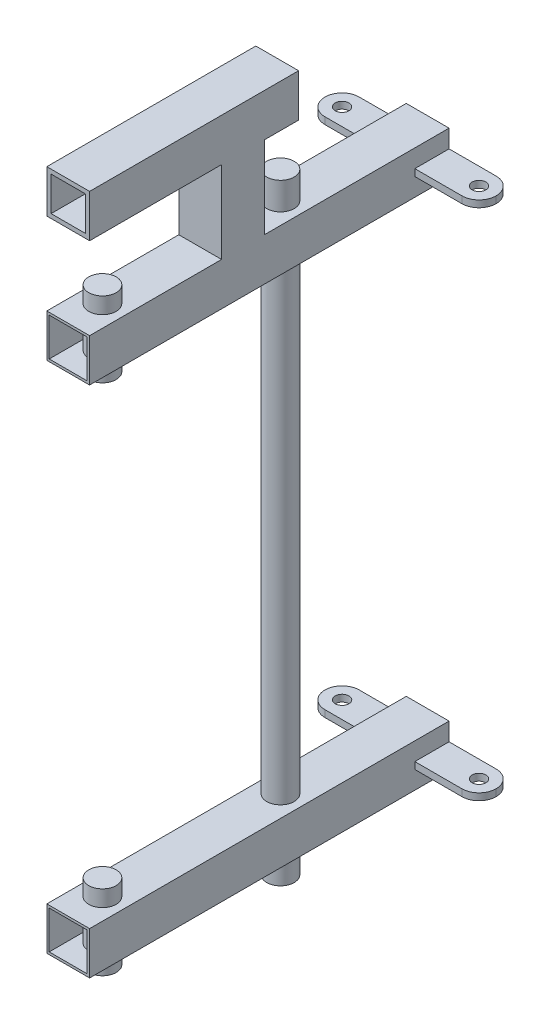
from build123d import *

# Parameters (mm, degrees)
SKETCH2_W                = 12.5
SKETCH2_H                = 12.5
SKETCH2_W_2              = 11.1
SKETCH2_H_2              = 11.1
BOSS_EXTRUDE1_DEPTH      = 105
SKETCH3_R                = 4
CUT_EXTRUDE1_DEPTH       = 105
SKETCH4_W                = 10
SKETCH4_H                = 2
BOSS_EXTRUDE2_DEPTH      = 25
FILLET1_R                = 5
SKETCH5_R                = 2
CUT_EXTRUDE2_DEPTH       = 40
BOSS_EXTRUDE3_START      = -82.5
SKETCH6_R                = 4
BOSS_EXTRUDE3_DEPTH      = 90.5
SKETCH8_W                = 12.5
SKETCH8_H                = 12.5
SKETCH8_W_2              = 11.1
SKETCH8_H_2              = 11.1
BOSS_EXTRUDE4_DEPTH      = 24
BOSS_EXTRUDE5_DEPTH      = 10
BOSS_EXTRUDE5_DEPTH_BACK = 51.049582
SKETCH9_W                = 12.5
SKETCH9_H                = 12.5
SKETCH9_W_2              = 10
SKETCH9_H_2              = 10
SKETCH11_R               = 4
BOSS_EXTRUDE6_DEPTH      = 11
SKETCH12_R               = 4
BOSS_EXTRUDE7_DEPTH      = 11


with BuildPart() as part:
    # Sketch2 → Boss-Extrude1 (new body)
    with BuildSketch(Plane.XY):
        Rectangle(SKETCH2_W, SKETCH2_H)
        Rectangle(SKETCH2_W_2, SKETCH2_H_2, mode=Mode.SUBTRACT)
    extrude(amount=BOSS_EXTRUDE1_DEPTH)

    # Sketch3 → Cut-Extrude1 (cut)
    with BuildSketch(Plane(origin=(0, 6.25, 0), x_dir=(1, 0, 0), z_dir=(0, 1, 0))):
        with Locations(Location((0, -95, 0), (0, 0, 180))):
            Circle(SKETCH3_R)
    extrude(amount=-CUT_EXTRUDE1_DEPTH, mode=Mode.SUBTRACT)

    # Sketch4 → Boss-Extrude2 (add, symmetric)
    with BuildSketch(Plane(origin=(0, 0, 0), x_dir=(0, 0, -1), z_dir=(1, 0, 0))):
        with Locations((-5, 0)):
            Rectangle(SKETCH4_W, SKETCH4_H)
    extrude(amount=BOSS_EXTRUDE2_DEPTH, both=True)

    # Fillet1
    fillet1_edges = [part.edges().sort_by_distance(p)[0] for p in [
        (-25, 0, 10),
        (-25, 0, 0),
        (25, 0, 10),
        (25, 0, 0),
    ]]
    fillet(fillet1_edges, radius=FILLET1_R - 0.0001)  # a hair under: the kernel refuses the full size

    # Sketch5 → Cut-Extrude2 (cut)
    with BuildSketch(Plane(origin=(0, 1, 0), x_dir=(1, 0, 0), z_dir=(0, 1, 0))):
        with Locations(Location((20, -5, 0), (0, 0, 270))):
            Circle(SKETCH5_R)
    cut_extrude2 = extrude(amount=-CUT_EXTRUDE2_DEPTH, mode=Mode.SUBTRACT)

    # Mirror1: Cut-Extrude2 across plane
    add(cut_extrude2.mirror(Plane(origin=(0, 0, 0), x_dir=(0, 0, 1), z_dir=(1, 0, 0))), mode=Mode.SUBTRACT)


with BuildPart() as body_2:
    # Mirror3: mirrored copy
    add(part.part.mirror(Plane(origin=(0, -75, 0), x_dir=(0, 0, 1), z_dir=(0, -1, 0))))



with BuildPart() as part_1:
    add(part.part)

    # Sketch6 → Boss-Extrude3 (add)
    with BuildSketch(Plane(origin=(0, 6.25, 0), x_dir=(1, 0, 0), z_dir=(0, 1, 0)).offset(BOSS_EXTRUDE3_START)):
        with Locations(Location((0, -43, 0), (0, 0, 180))):
            Circle(SKETCH6_R)
    boss_extrude3 = extrude(amount=BOSS_EXTRUDE3_DEPTH)

    # Mirror4: Boss-Extrude3 across plane
    add(boss_extrude3.mirror(Plane(origin=(0, -75, 0), x_dir=(0, 0, 1), z_dir=(0, -1, 0))))

    # Sketch8 → Boss-Extrude4 (add)
    with BuildSketch(Plane(origin=(0, 6.25, 0), x_dir=(1, 0, 0), z_dir=(0, 1, 0))):
        with Locations((0, -60.200417772)):
            Rectangle(SKETCH8_W, SKETCH8_H)
        with Locations((0, -60.200417772)):
            Rectangle(SKETCH8_W_2, SKETCH8_H_2, mode=Mode.SUBTRACT)
    extrude(amount=BOSS_EXTRUDE4_DEPTH)

    # Sketch9 → Boss-Extrude5 (add, two sides: drawn at the far end of the back side and taken through both)
    with BuildSketch(Plane(origin=(0, 0, 53.950417772), x_dir=(-1, 0, 0), z_dir=(0, 0, -1)).offset(-BOSS_EXTRUDE5_DEPTH_BACK)):
        with Locations((0, 36.5)):
            Rectangle(SKETCH9_W, SKETCH9_H)
        with Locations((0, 36.5)):
            Rectangle(SKETCH9_W_2, SKETCH9_H_2, mode=Mode.SUBTRACT)
    extrude(amount=BOSS_EXTRUDE5_DEPTH + BOSS_EXTRUDE5_DEPTH_BACK)

    # Sketch11 → Boss-Extrude6 (add, symmetric)
    with BuildSketch(Plane(origin=(0, 0, 0), x_dir=(1, 0, 0), z_dir=(0, 1, 0))):
        with Locations(Location((0, -95, 0), (0, 0, 180))):
            Circle(SKETCH11_R)
    extrude(amount=BOSS_EXTRUDE6_DEPTH, both=True)


with BuildPart() as body_2_1:
    add(body_2.part)

    add(part_1.part)  # Boss-Extrude7 merges part
    # Sketch12 → Boss-Extrude7 (add, symmetric)
    with BuildSketch(Plane(origin=(0, -150, 0), x_dir=(-1, 0, 0), z_dir=(0, -1, 0))):
        with Locations((0, -95)):
            Circle(SKETCH12_R)
    extrude(amount=BOSS_EXTRUDE7_DEPTH, both=True)


solid = body_2_1.part
